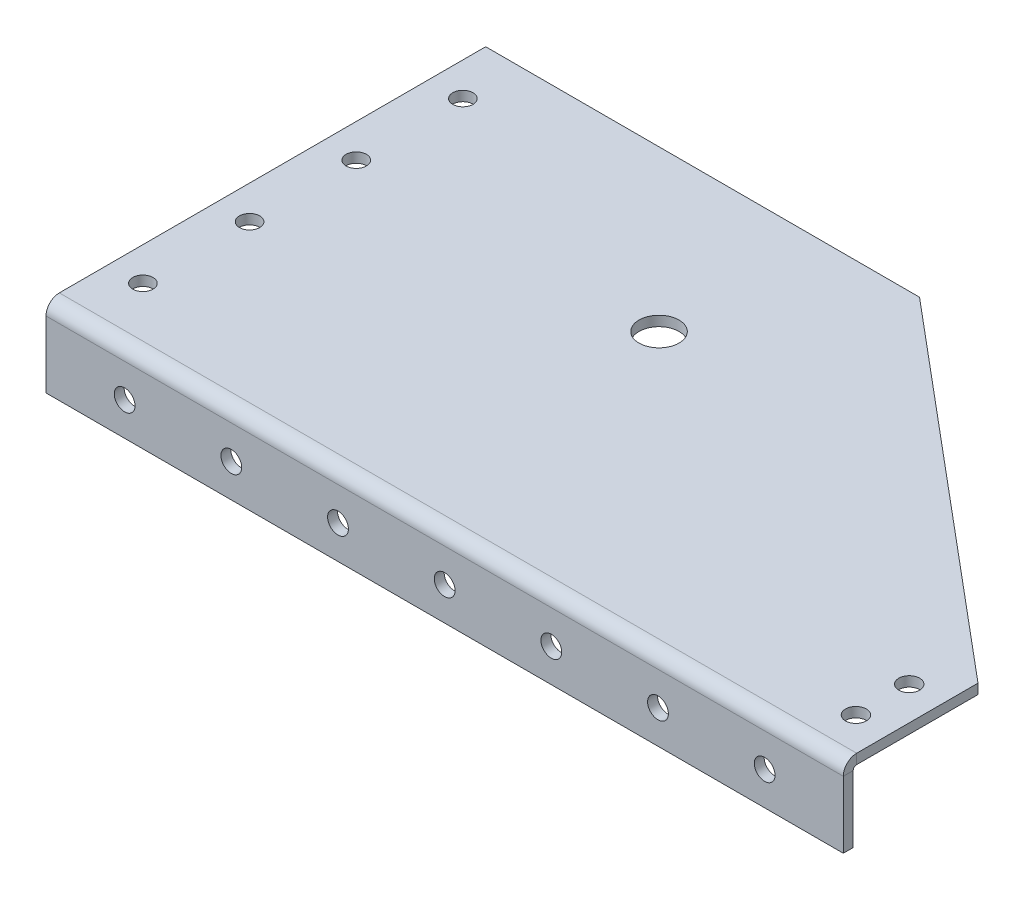
from build123d import *

# Parameters (mm, degrees)
SKETCH1_W                    = 189.8572
SKETCH1_H                    = 175.514
BASE_FLANGE1_DEPTH           = 2.3622
EDGE_FLANGE4_STRIP_W         = 11.0744
EDGE_FLANGE4_STRIP_H         = 2.3622
EDGE_FLANGE4_STRIP_CUT_DEPTH = 189.8572
EDGE_FLANGE4_DEPTH           = 189.8572
CUT_EXTRUDE1_DEPTH           = 145.352665205
CUT_EXTRUDE5_REACH           = 151.669
SKETCH41_R                   = 2.4765
CUT_EXTRUDE6_REACH           = 138.891
SKETCH42_R                   = 2.413
SKETCH42_R_2                 = 2.4765
CUT_EXTRUDE7_REACH           = 138.891
SKETCH43_R                   = 4.7625


# Sheet-metal steps are written as plain solids
with BuildPart() as part:
    # Sketch1 → Base-Flange1 (new body)
    with BuildSketch(Plane(origin=(0, 0, 0), x_dir=(1, 0, 0), z_dir=(0, 1, 0))):
        with Locations((12.6128, 7.08)):
            Rectangle(SKETCH1_W, SKETCH1_H)
    extrude(amount=-BASE_FLANGE1_DEPTH)

    # Edge-Flange4 strip (across the edge) → Edge-Flange4 strip cut (cut)
    with BuildSketch(Plane(origin=(107.5414, -2.3622, 80.677), x_dir=(0, 0, -1), z_dir=(-1, 0, 0))):
        with Locations((-4.7244, -1.1811)):
            Rectangle(EDGE_FLANGE4_STRIP_W, EDGE_FLANGE4_STRIP_H)
    extrude(amount=EDGE_FLANGE4_STRIP_CUT_DEPTH, mode=Mode.SUBTRACT)

    # Edge-Flange4 section (across the edge) → Edge-Flange4 (add)
    with BuildSketch(Plane(origin=(107.5414, -2.3622, 80.677), x_dir=(0, 0, -1), z_dir=(-1, 0, 0))):
        with BuildLine():
            Line((-2.3622, 0.8128), (-2.3622, 16.6878))
            Line((-2.3622, 16.6878), (0, 16.6878))
            Line((0, 16.6878), (0, 0.8128))
            ThreePointArc((0, 0.8128), (0.238063608, 0.238063608), (0.8128, 0))
            Line((0.8128, 0), (0.8128, -2.3622))
            ThreePointArc((0.8128, -2.3622), (-1.43226403, -1.43226403), (-2.3622, 0.8128))
        make_face()
    extrude(amount=EDGE_FLANGE4_DEPTH)

    # Sketch36 → Cut-Extrude1 (cut, through all)
    with BuildSketch(Plane.XZ.offset(2.3622)):
        Polygon((20.98856689, -21.6596), (-82.3158, -21.6596), (-82.3158, -94.837), (107.5414, -94.837), (107.5414, 50.96685034), align=None)
    extrude(amount=-CUT_EXTRUDE1_DEPTH, mode=Mode.SUBTRACT)

    # Sketch41 → Cut-Extrude5 (cut, up to next)
    with BuildSketch(Plane(origin=(0, 0, 80.677), x_dir=(-1, 0, 0), z_dir=(0, 0, -1)), mode=Mode.PRIVATE) as cut_extrude5_sk1:
        with Locations(Location((-88.8128, -11.1125, 0), (0, 0, 90))):
            Circle(SKETCH41_R)
    cut_extrude5_tool1 = extrude(cut_extrude5_sk1.sketch, amount=-CUT_EXTRUDE5_REACH, mode=Mode.PRIVATE) & part.part
    # Sketch41 → Cut-Extrude5 (cut, up to next)
    with BuildSketch(Plane(origin=(0, 0, 80.677), x_dir=(-1, 0, 0), z_dir=(0, 0, -1)), mode=Mode.PRIVATE) as cut_extrude5_sk2:
        with Locations(Location((-63.4128, -11.1125, 0), (0, 0, 90))):
            Circle(SKETCH41_R)
    cut_extrude5_tool2 = extrude(cut_extrude5_sk2.sketch, amount=-CUT_EXTRUDE5_REACH, mode=Mode.PRIVATE) & part.part
    # Sketch41 → Cut-Extrude5 (cut, up to next)
    with BuildSketch(Plane(origin=(0, 0, 80.677), x_dir=(-1, 0, 0), z_dir=(0, 0, -1)), mode=Mode.PRIVATE) as cut_extrude5_sk3:
        with Locations(Location((-38.0128, -11.1125, 0), (0, 0, 90))):
            Circle(SKETCH41_R)
    cut_extrude5_tool3 = extrude(cut_extrude5_sk3.sketch, amount=-CUT_EXTRUDE5_REACH, mode=Mode.PRIVATE) & part.part
    # Sketch41 → Cut-Extrude5 (cut, up to next)
    with BuildSketch(Plane(origin=(0, 0, 80.677), x_dir=(-1, 0, 0), z_dir=(0, 0, -1)), mode=Mode.PRIVATE) as cut_extrude5_sk4:
        with Locations(Location((-12.6128, -11.1125, 0), (0, 0, 90))):
            Circle(SKETCH41_R)
    cut_extrude5_tool4 = extrude(cut_extrude5_sk4.sketch, amount=-CUT_EXTRUDE5_REACH, mode=Mode.PRIVATE) & part.part
    # Sketch41 → Cut-Extrude5 (cut, up to next)
    with BuildSketch(Plane(origin=(0, 0, 80.677), x_dir=(-1, 0, 0), z_dir=(0, 0, -1)), mode=Mode.PRIVATE) as cut_extrude5_sk5:
        with Locations(Location((12.7872, -11.1125, 0), (0, 0, 90))):
            Circle(SKETCH41_R)
    cut_extrude5_tool5 = extrude(cut_extrude5_sk5.sketch, amount=-CUT_EXTRUDE5_REACH, mode=Mode.PRIVATE) & part.part
    # Sketch41 → Cut-Extrude5 (cut, up to next)
    with BuildSketch(Plane(origin=(0, 0, 80.677), x_dir=(-1, 0, 0), z_dir=(0, 0, -1)), mode=Mode.PRIVATE) as cut_extrude5_sk6:
        with Locations(Location((38.1872, -11.1125, 0), (0, 0, 90))):
            Circle(SKETCH41_R)
    cut_extrude5_tool6 = extrude(cut_extrude5_sk6.sketch, amount=-CUT_EXTRUDE5_REACH, mode=Mode.PRIVATE) & part.part
    # Sketch41 → Cut-Extrude5 (cut, up to next)
    with BuildSketch(Plane(origin=(0, 0, 80.677), x_dir=(-1, 0, 0), z_dir=(0, 0, -1)), mode=Mode.PRIVATE) as cut_extrude5_sk7:
        with Locations(Location((63.5872, -11.1125, 0), (0, 0, 90))):
            Circle(SKETCH41_R)
    cut_extrude5_tool7 = extrude(cut_extrude5_sk7.sketch, amount=-CUT_EXTRUDE5_REACH, mode=Mode.PRIVATE) & part.part
    add(cut_extrude5_tool1.solids().sort_by_distance((88.8128, -11.1125, 80.677))[0], mode=Mode.SUBTRACT)
    add(cut_extrude5_tool2.solids().sort_by_distance((63.4128, -11.1125, 80.677))[0], mode=Mode.SUBTRACT)
    add(cut_extrude5_tool3.solids().sort_by_distance((38.0128, -11.1125, 80.677))[0], mode=Mode.SUBTRACT)
    add(cut_extrude5_tool4.solids().sort_by_distance((12.6128, -11.1125, 80.677))[0], mode=Mode.SUBTRACT)
    add(cut_extrude5_tool5.solids().sort_by_distance((-12.7872, -11.1125, 80.677))[0], mode=Mode.SUBTRACT)
    add(cut_extrude5_tool6.solids().sort_by_distance((-38.1872, -11.1125, 80.677))[0], mode=Mode.SUBTRACT)
    add(cut_extrude5_tool7.solids().sort_by_distance((-63.5872, -11.1125, 80.677))[0], mode=Mode.SUBTRACT)

    # Sketch42 → Cut-Extrude6 (cut, up to next)
    with BuildSketch(Plane.XZ.offset(2.3622), mode=Mode.PRIVATE) as cut_extrude6_sk1:
        with Locations(Location((-74.3402, -8.2596, 0), (0, 0, 270))):
            Circle(SKETCH42_R)
    cut_extrude6_tool1 = extrude(cut_extrude6_sk1.sketch, amount=-CUT_EXTRUDE6_REACH, mode=Mode.PRIVATE) & part.part
    # Sketch42 → Cut-Extrude6 (cut, up to next)
    with BuildSketch(Plane.XZ.offset(2.3622), mode=Mode.PRIVATE) as cut_extrude6_sk2:
        with Locations(Location((-74.3402, 17.1404, 0), (0, 0, 270))):
            Circle(SKETCH42_R)
    cut_extrude6_tool2 = extrude(cut_extrude6_sk2.sketch, amount=-CUT_EXTRUDE6_REACH, mode=Mode.PRIVATE) & part.part
    # Sketch42 → Cut-Extrude6 (cut, up to next)
    with BuildSketch(Plane.XZ.offset(2.3622), mode=Mode.PRIVATE) as cut_extrude6_sk3:
        with Locations(Location((-74.3402, 42.5404, 0), (0, 0, 270))):
            Circle(SKETCH42_R)
    cut_extrude6_tool3 = extrude(cut_extrude6_sk3.sketch, amount=-CUT_EXTRUDE6_REACH, mode=Mode.PRIVATE) & part.part
    # Sketch42 → Cut-Extrude6 (cut, up to next)
    with BuildSketch(Plane.XZ.offset(2.3622), mode=Mode.PRIVATE) as cut_extrude6_sk4:
        with Locations(Location((-74.3402, 67.9404, 0), (0, 0, 270))):
            Circle(SKETCH42_R)
    cut_extrude6_tool4 = extrude(cut_extrude6_sk4.sketch, amount=-CUT_EXTRUDE6_REACH, mode=Mode.PRIVATE) & part.part
    # Sketch42 → Cut-Extrude6 (cut, up to next)
    with BuildSketch(Plane.XZ.offset(2.3622), mode=Mode.PRIVATE) as cut_extrude6_sk5:
        with Locations(Location((99.5658, 59.3664, 0), (0, 0, 270))):
            Circle(SKETCH42_R_2)
    cut_extrude6_tool5 = extrude(cut_extrude6_sk5.sketch, amount=-CUT_EXTRUDE6_REACH, mode=Mode.PRIVATE) & part.part
    # Sketch42 → Cut-Extrude6 (cut, up to next)
    with BuildSketch(Plane.XZ.offset(2.3622), mode=Mode.PRIVATE) as cut_extrude6_sk6:
        with Locations(Location((99.5658, 72.0664, 0), (0, 0, 270))):
            Circle(SKETCH42_R_2)
    cut_extrude6_tool6 = extrude(cut_extrude6_sk6.sketch, amount=-CUT_EXTRUDE6_REACH, mode=Mode.PRIVATE) & part.part
    add(cut_extrude6_tool1.solids().sort_by_distance((-74.3402, -2.3622, -8.2596))[0], mode=Mode.SUBTRACT)
    add(cut_extrude6_tool2.solids().sort_by_distance((-74.3402, -2.3622, 17.1404))[0], mode=Mode.SUBTRACT)
    add(cut_extrude6_tool3.solids().sort_by_distance((-74.3402, -2.3622, 42.5404))[0], mode=Mode.SUBTRACT)
    add(cut_extrude6_tool4.solids().sort_by_distance((-74.3402, -2.3622, 67.9404))[0], mode=Mode.SUBTRACT)
    add(cut_extrude6_tool5.solids().sort_by_distance((99.5658, -2.3622, 59.3664))[0], mode=Mode.SUBTRACT)
    add(cut_extrude6_tool6.solids().sort_by_distance((99.5658, -2.3622, 72.0664))[0], mode=Mode.SUBTRACT)

    # Sketch43 → Cut-Extrude7 (cut, up to next)
    with BuildSketch(Plane.XZ.offset(2.3622), mode=Mode.PRIVATE) as cut_extrude7_sk1:
        with Locations(Location((-2.9408, 16.4404, 0), (0, 0, 270))):
            Circle(SKETCH43_R)
    cut_extrude7_tool1 = extrude(cut_extrude7_sk1.sketch, amount=-CUT_EXTRUDE7_REACH, mode=Mode.PRIVATE) & part.part
    add(cut_extrude7_tool1.solids().sort_by_distance((-2.9408, -2.3622, 16.4404))[0], mode=Mode.SUBTRACT)


solid = part.part
